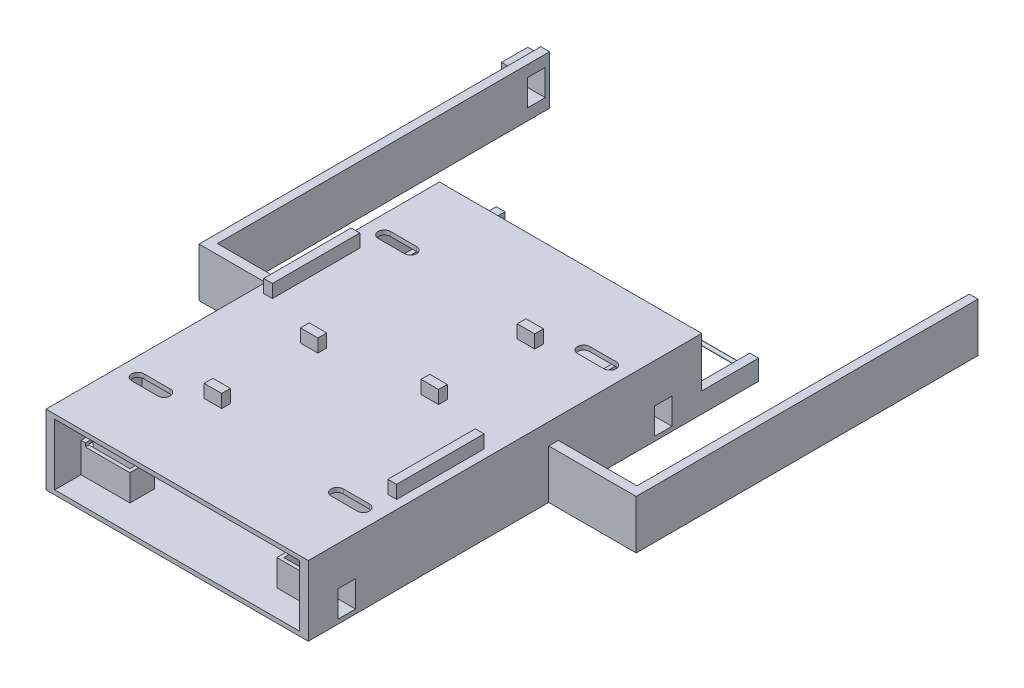
from build123d import *

# Parameters (mm, degrees)
SKETCH2_W            = 150
SKETCH2_H            = 40
BOSS_EXTRUDE1_DEPTH  = 225
SKETCH3_W            = 140
SKETCH3_H            = 35
CUT_EXTRUDE1_DEPTH   = 50
SKETCH4_W            = 26
SKETCH4_H            = 2
SKETCH4_W_2          = 20
BOSS_EXTRUDE2_DEPTH  = 15
SKETCH6_W            = 10
SKETCH6_H            = 15
CUT_EXTRUDE2_DEPTH   = 15
CUT_EXTRUDE3_DEPTH   = 67
SKETCH9_W            = 10
SKETCH9_H            = 15
CUT_EXTRUDE4_DEPTH   = 67
SKETCH12_W           = 14
SKETCH12_H           = 2
BOSS_EXTRUDE3_DEPTH  = 2.5
FILLET1_R            = 0.5
MIRROR3_START        = 196
MIRROR3_DEPTH        = 14
MIRROR3_START_2      = 15
MIRROR3_2_DEPTH      = 14
MIRROR3_3_DEPTH      = 2
MIRROR3_START_3      = 208
MIRROR3_4_DEPTH      = 2
MIRROR3_5_DEPTH      = 2
MIRROR3_START_4      = 27
MIRROR3_6_DEPTH      = 2
SKETCH16_W           = 32.5
SKETCH16_H           = 11.5
BOSS_EXTRUDE5_DEPTH  = 5
SKETCH17_R           = 1
BOSS_EXTRUDE7_DEPTH  = 25
SKETCH18_W           = 5
SKETCH18_H           = 50
SKETCH18_W_2         = 10
SKETCH18_H_2         = 5
BOSS_EXTRUDE8_DEPTH  = 7.5
SKETCH24_W           = 5.5
SKETCH24_H           = 28
BOSS_EXTRUDE11_DEPTH = 50
SKETCH25_W           = 5
SKETCH25_H           = 28
BOSS_EXTRUDE12_DEPTH = 190
SKETCH26_W           = 5
SKETCH26_H           = 28
BOSS_EXTRUDE13_DEPTH = 190
SKETCH27_R           = 2.55
BOSS_EXTRUDE14_DEPTH = 10
SKETCH29_W           = 10
SKETCH29_H           = 15
CUT_EXTRUDE5_DEPTH   = 19
SKETCH30_W           = 15
SKETCH30_H           = 20
BOSS_EXTRUDE15_DEPTH = 7.5
SKETCH32_W           = 10
SKETCH32_H           = 15
CUT_EXTRUDE6_DEPTH   = 19


# Read off the part's stored shape, not the designer's step: Mirror3
with BuildPart() as part:
    # Sketch2 → Boss-Extrude1 (new body)
    with BuildSketch(Plane.XY):
        Rectangle(SKETCH2_W, SKETCH2_H)
    extrude(amount=BOSS_EXTRUDE1_DEPTH)

    # Sketch3 → Cut-Extrude1 (cut)
    with BuildSketch(Plane.XY.offset(225)):
        Rectangle(SKETCH3_W, SKETCH3_H)
    cut_extrude1 = extrude(amount=-CUT_EXTRUDE1_DEPTH, mode=Mode.SUBTRACT)

    # Sketch4 → Boss-Extrude2 (add)
    with BuildSketch(Plane(origin=(0, -17.5, 0), x_dir=(1, 0, 0), z_dir=(0, 1, 0))):
        Polygon((-42, -196), (-44, -196), (-44, -208), (-44, -210), (-42, -210), align=None)
        with Locations((-57, -209)):
            Rectangle(SKETCH4_W, SKETCH4_H)
        with Locations((-60, -197)):
            Rectangle(SKETCH4_W_2, SKETCH4_H)
        Polygon((70, -210), (70, -208), (44, -208), (44, -196), (42, -196), (42, -210), (44, -210), align=None)
        with Locations((60, -197)):
            Rectangle(SKETCH4_W_2, SKETCH4_H)
    boss_extrude2 = extrude(amount=BOSS_EXTRUDE2_DEPTH)

    # Sketch6 → Cut-Extrude2 (cut)
    with BuildSketch(Plane(origin=(-70, 0, 0), x_dir=(0, 0, -1), z_dir=(1, 0, 0))):
        with Locations((-203, -10)):
            Rectangle(SKETCH6_W, SKETCH6_H)
    cut_extrude2 = extrude(amount=-CUT_EXTRUDE2_DEPTH, mode=Mode.SUBTRACT)

    # Sketch8 → Cut-Extrude3 (cut)
    with BuildSketch(Plane(origin=(0, -17.5, 0), x_dir=(1, 0, 0), z_dir=(0, 1, 0))):
        with BuildLine():
            Line((-64.5, -179.5), (-49.5, -179.5))
            ThreePointArc((-49.5, -179.5), (-46, -183), (-49.5, -186.5))
            Line((-49.5, -186.5), (-64.5, -186.5))
            ThreePointArc((-64.5, -186.5), (-68, -183), (-64.5, -179.5))
        make_face()
        with BuildLine():
            Line((64.5, -179.5), (49.5, -179.5))
            ThreePointArc((49.5, -179.5), (46, -183), (49.5, -186.5))
            Line((49.5, -186.5), (64.5, -186.5))
            ThreePointArc((64.5, -186.5), (68, -183), (64.5, -179.5))
        make_face()
    cut_extrude3 = extrude(amount=CUT_EXTRUDE3_DEPTH, mode=Mode.SUBTRACT)

    # Sketch9 → Cut-Extrude4 (cut)
    with BuildSketch(Plane.ZY.offset(-70)):
        with Locations((203, -10)):
            Rectangle(SKETCH9_W, SKETCH9_H)
    cut_extrude4 = extrude(amount=-CUT_EXTRUDE4_DEPTH, mode=Mode.SUBTRACT)

    # Mirror1: Cut-Extrude1, Boss-Extrude2, Cut-Extrude2, Cut-Extrude3, Cut-Extrude4 across plane
    add(cut_extrude1.mirror(Plane.XY.offset(112.5)), mode=Mode.SUBTRACT)
    add(boss_extrude2.mirror(Plane.XY.offset(112.5)))
    add(cut_extrude2.mirror(Plane.XY.offset(112.5)), mode=Mode.SUBTRACT)
    add(cut_extrude3.mirror(Plane.XY.offset(112.5)), mode=Mode.SUBTRACT)
    add(cut_extrude4.mirror(Plane.XY.offset(112.5)), mode=Mode.SUBTRACT)

    # Sketch12 → Boss-Extrude3 (add)
    with BuildSketch(Plane.ZY.offset(-70)):
        with Locations((22, -1.5)):
            Rectangle(SKETCH12_W, SKETCH12_H)
    extrude(amount=BOSS_EXTRUDE3_DEPTH)

    # Fillet1
    fillet1_edges = [part.edges().sort_by_distance(p)[0] for p in [
        (67.5, -2.5, 22),
    ]]
    fillet(fillet1_edges, radius=FILLET1_R)

    # Mirror3 outline → Mirror3 (add)
    with BuildSketch(Plane.XY.offset(MIRROR3_START)):
        with BuildLine():
            Line((-70, -2.5), (-68, -2.5))
            ThreePointArc((-68, -2.5), (-67.646446609, -2.353553391), (-67.5, -2))
            Line((-67.5, -2), (-67.5, -0.5))
            Line((-67.5, -0.5), (-70, -0.5))
            Line((-70, -0.5), (-70, -2.5))
        make_face()
        with BuildLine():
            Line((68, -2.5), (70, -2.5))
            Line((70, -2.5), (70, -0.5))
            Line((70, -0.5), (67.5, -0.5))
            Line((67.5, -0.5), (67.5, -2))
            ThreePointArc((67.5, -2), (67.646446609, -2.353553391), (68, -2.5))
        make_face()
    extrude(amount=MIRROR3_DEPTH)

    # Mirror3 2 outline → Mirror3 2 (add)
    with BuildSketch(Plane.XY.offset(MIRROR3_START_2)):
        with BuildLine():
            Line((-70, -2.5), (-68, -2.5))
            ThreePointArc((-68, -2.5), (-67.646446609, -2.353553391), (-67.5, -2))
            Line((-67.5, -2), (-67.5, -0.5))
            Line((-67.5, -0.5), (-70, -0.5))
            Line((-70, -0.5), (-70, -2.5))
        make_face()
    extrude(amount=MIRROR3_2_DEPTH)

    # Mirror3 3 outline → Mirror3 3 (add)
    with BuildSketch(Plane.XY.offset(MIRROR3_START)):
        with BuildLine():
            ThreePointArc((-67.5, -2), (-67.646446609, -2.353553391), (-68, -2.5))
            Line((-68, -2.5), (-67.5, -2.5))
            Line((-67.5, -2.5), (-67.5, -2))
        make_face()
        with BuildLine():
            Line((67.5, -2.5), (68, -2.5))
            ThreePointArc((68, -2.5), (67.646446609, -2.353553391), (67.5, -2))
            Line((67.5, -2), (67.5, -2.5))
        make_face()
    extrude(amount=MIRROR3_3_DEPTH)

    # Mirror3 4 outline → Mirror3 4 (add)
    with BuildSketch(Plane.XY.offset(MIRROR3_START_3)):
        with BuildLine():
            ThreePointArc((-67.5, -2), (-67.646446609, -2.353553391), (-68, -2.5))
            Line((-68, -2.5), (-67.5, -2.5))
            Line((-67.5, -2.5), (-67.5, -2))
        make_face()
        with BuildLine():
            Line((67.5, -2.5), (68, -2.5))
            ThreePointArc((68, -2.5), (67.646446609, -2.353553391), (67.5, -2))
            Line((67.5, -2), (67.5, -2.5))
        make_face()
    extrude(amount=MIRROR3_4_DEPTH)

    # Mirror3 5 outline → Mirror3 5 (add)
    with BuildSketch(Plane.XY.offset(MIRROR3_START_2)):
        with BuildLine():
            ThreePointArc((-67.5, -2), (-67.646446609, -2.353553391), (-68, -2.5))
            Line((-68, -2.5), (-67.5, -2.5))
            Line((-67.5, -2.5), (-67.5, -2))
        make_face()
    extrude(amount=MIRROR3_5_DEPTH)

    # Mirror3 6 outline → Mirror3 6 (add)
    with BuildSketch(Plane.XY.offset(MIRROR3_START_4)):
        with BuildLine():
            ThreePointArc((-67.5, -2), (-67.646446609, -2.353553391), (-68, -2.5))
            Line((-68, -2.5), (-67.5, -2.5))
            Line((-67.5, -2.5), (-67.5, -2))
        make_face()
    extrude(amount=MIRROR3_6_DEPTH)

    # Sketch16 → Boss-Extrude5 (add)
    with BuildSketch(Plane(origin=(-70, 0, 0), x_dir=(0, 0, -1), z_dir=(1, 0, 0))):
        with Locations((16.25, -14.25)):
            Rectangle(SKETCH16_W, SKETCH16_H)
    boss_extrude5 = extrude(amount=-BOSS_EXTRUDE5_DEPTH)

    # Mirror4: Boss-Extrude5 across plane
    add(boss_extrude5.mirror(Plane(origin=(0, 0, 0), x_dir=(0, 0, 1), z_dir=(1, 0, 0))))

    # Sketch17 → Boss-Extrude7 (add)
    with BuildSketch(Plane.ZY.offset(-70)):
        with Locations(Location((-29.5, -14.25, 0), (0, 0, 270))):
            Circle(SKETCH17_R)
        with Locations(Location((-3, -14.25, 0), (0, 0, 270))):
            Circle(SKETCH17_R)
    boss_extrude7 = extrude(amount=BOSS_EXTRUDE7_DEPTH)

    # Mirror5: Boss-Extrude7 across plane
    add(boss_extrude7.mirror(Plane(origin=(0, 0, 0), x_dir=(0, 0, 1), z_dir=(1, 0, 0))))

    # Sketch18 → Boss-Extrude8 (add)
    with BuildSketch(Plane(origin=(0, 20, 0), x_dir=(1, 0, 0), z_dir=(0, 1, 0))):
        with Locations((-67.5, -80.5)):
            Rectangle(SKETCH18_W, SKETCH18_H)
        with Locations((67.5, -144.5)):
            Rectangle(SKETCH18_W, SKETCH18_H)
        with Locations((-30, -172)):
            Rectangle(SKETCH18_W_2, SKETCH18_H_2)
        with Locations((-30, -117)):
            Rectangle(SKETCH18_W_2, SKETCH18_H_2)
        with Locations((30, -108)):
            Rectangle(SKETCH18_W_2, SKETCH18_H_2)
        with Locations((30, -53)):
            Rectangle(SKETCH18_W_2, SKETCH18_H_2)
    extrude(amount=BOSS_EXTRUDE8_DEPTH)

    # Sketch24 → Boss-Extrude11 (add)
    with BuildSketch(Plane.ZY.offset(75)):
        with Locations((84.75, -6)):
            Rectangle(SKETCH24_W, SKETCH24_H)
    boss_extrude11 = extrude(amount=BOSS_EXTRUDE11_DEPTH)

    # Sketch25 → Boss-Extrude12 (add)
    with BuildSketch(Plane(origin=(0, 0, 82), x_dir=(-1, 0, 0), z_dir=(0, 0, -1))):
        with Locations((122.5, -6)):
            Rectangle(SKETCH25_W, SKETCH25_H)
    extrude(amount=BOSS_EXTRUDE12_DEPTH)

    # Mirror12: Boss-Extrude11 across plane
    add(boss_extrude11.mirror(Plane(origin=(0, 0, 0), x_dir=(0, 0, 1), z_dir=(1, 0, 0))))

    # Sketch26 → Boss-Extrude13 (add)
    with BuildSketch(Plane(origin=(0, 0, 82), x_dir=(-1, 0, 0), z_dir=(0, 0, -1))):
        with Locations((-122.5, -6)):
            Rectangle(SKETCH26_W, SKETCH26_H)
    extrude(amount=BOSS_EXTRUDE13_DEPTH)

    # Sketch27 → Boss-Extrude14 (add)
    with BuildSketch(Plane.ZY.offset(-120)):
        with Locations(Location((-100.5, -6, 0), (0, 0, 180))):
            Circle(SKETCH27_R)
    boss_extrude14 = extrude(amount=BOSS_EXTRUDE14_DEPTH)

    # Mirror13: Boss-Extrude14 across plane
    add(boss_extrude14.mirror(Plane(origin=(0, 0, 0), x_dir=(0, 0, 1), z_dir=(1, 0, 0))))

    # Sketch29 → Cut-Extrude5 (cut)
    with BuildSketch(Plane.ZY.offset(125)):
        with Locations((-100.5, -6)):
            Rectangle(SKETCH29_W, SKETCH29_H)
    extrude(amount=-CUT_EXTRUDE5_DEPTH, mode=Mode.SUBTRACT)

    # Sketch30 → Boss-Extrude15 (add)
    with BuildSketch(Plane.ZY.offset(125)):
        with Locations((-100.5, -6)):
            Rectangle(SKETCH30_W, SKETCH30_H)
    extrude(amount=BOSS_EXTRUDE15_DEPTH)

    # Sketch32 → Cut-Extrude6 (cut)
    with BuildSketch(Plane(origin=(-125, 0, 0), x_dir=(0, 0, -1), z_dir=(1, 0, 0))):
        with Locations((100.5, -6)):
            Rectangle(SKETCH32_W, SKETCH32_H)
    extrude(amount=-CUT_EXTRUDE6_DEPTH, mode=Mode.SUBTRACT)


solid = part.part
